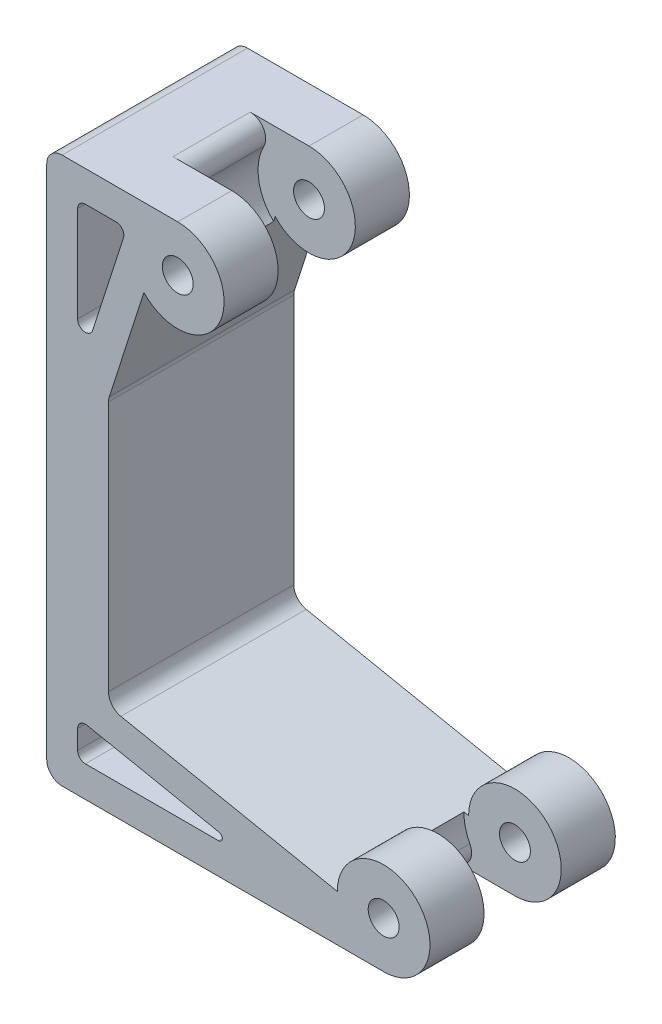
from build123d import *

# Parameters (mm, degrees)
SKETCH1_R               = 1
BOSS_EXTRUDE1_DEPTH     = 12
CUT_EXTRUDE1_DEPTH      = 2.5
CUT_EXTRUDE1_DEPTH_BACK = 2.5
SKETCH2_R               = 3.3
FILLET1_R               = 1
FILLET2_R               = 1
FILLET3_R               = 1
FILLET4_R               = 0.5
FILLET5_R               = 0.25


with BuildPart() as part:
    # Sketch1 → Boss-Extrude1 (new body)
    with BuildSketch(Plane.XY):
        with BuildLine():
            Line((0, 0), (21.817354946, 0))
            ThreePointArc((21.817354946, 0), (23.938675289, 5.121320344), (18.817354946, 3))
            Line((18.817354946, 3), (4, 5.97347684))
            Line((4, 5.97347684), (4, 23.200108131))
            Line((4, 23.200108131), (6.297593783, 30.327226275))
            ThreePointArc((6.297593783, 30.327226275), (11.237097985, 31.191049803), (8.483562347, 35.381865278))
            Line((8.483562347, 35.381865278), (0, 35.381865278))
            Line((0, 35.381865278), (0, 0))
        make_face()
        with Locations((8.483562347, 32.381865278)):
            Circle(SKETCH1_R, mode=Mode.SUBTRACT)
        with Locations((21.817354946, 3)):
            Circle(SKETCH1_R, mode=Mode.SUBTRACT)
        Polygon((5.180971974, 33.381865278), (2, 33.381865278), (2, 23.514514817), align=None, mode=Mode.SUBTRACT)
        Polygon((2, 2), (2, 4.334954297), (13.63548548, 2), align=None, mode=Mode.SUBTRACT)
    extrude(amount=BOSS_EXTRUDE1_DEPTH)

    # Sketch2 → Cut-Extrude1 (cut, two sides: drawn at the far end of the back side and taken through both)
    with BuildSketch(Plane.XY.offset(6).offset(-CUT_EXTRUDE1_DEPTH_BACK)):
        with Locations((8.483562347, 32.381865278)):
            Circle(SKETCH2_R)
        with Locations((21.817354946, 3)):
            Circle(SKETCH2_R)
    extrude(amount=CUT_EXTRUDE1_DEPTH + CUT_EXTRUDE1_DEPTH_BACK, mode=Mode.SUBTRACT)

    # Fillet1
    fillet1_edges = [part.edges().sort_by_distance(p)[0] for p in [
        (0, 0, 6),
        (0, 35.381865278, 6),
    ]]
    fillet(fillet1_edges, radius=FILLET1_R)

    # Fillet2
    fillet2_edges = [part.edges().sort_by_distance(p)[0] for p in [
        (4, 5.97347684, 6),
        (4, 23.200108131, 6),
    ]]
    fillet(fillet2_edges, radius=FILLET2_R)

    # Fillet3
    fillet3_edges = [part.edges().sort_by_distance(p)[0] for p in [
        (7.108789639, 35.381865278, 6),
        (20.442582237, 0, 6),
    ]]
    fillet(fillet3_edges, radius=FILLET3_R)

    # Fillet4
    fillet4_edges = [part.edges().sort_by_distance(p)[0] for p in [
        (2, 23.514514817, 6),
        (5.180971974, 33.381865278, 6),
        (2, 33.381865278, 6),
        (2, 2, 6),
        (2, 4.334954297, 6),
    ]]
    fillet(fillet4_edges, radius=FILLET4_R)

    # Fillet5
    fillet5_edges = [part.edges().sort_by_distance(p)[0] for p in [
        (13.63548548, 2, 6),
    ]]
    fillet(fillet5_edges, radius=FILLET5_R)


solid = part.part
